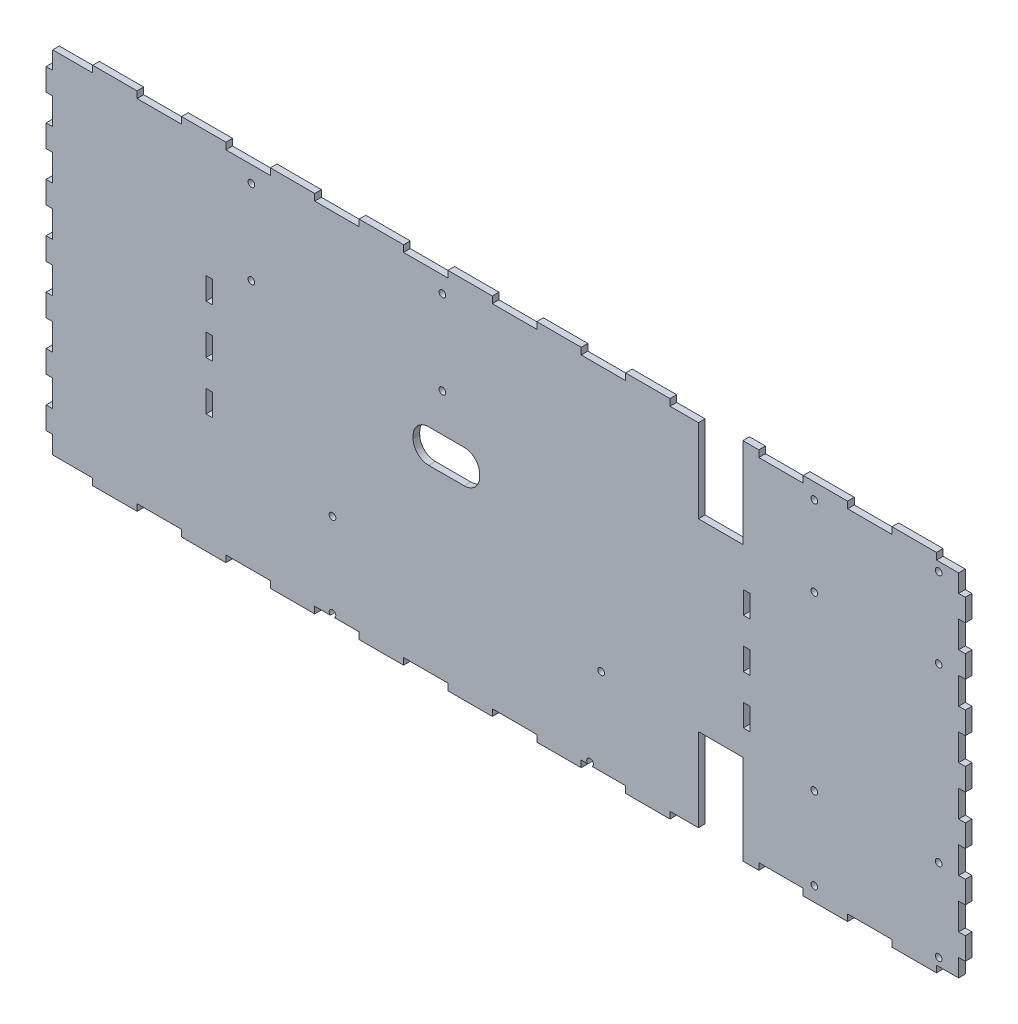
from build123d import *

# Parameters (mm, degrees)
SKETCH1_W           = 414
SKETCH1_H           = 164
BOSS_EXTRUDE1_DEPTH = 3
SKETCH2_W           = 3
SKETCH2_H           = 11
SKETCH2_H_2         = 12
CUT_EXTRUDE1_DEPTH  = 3
CUT_EXTRUDE2_DEPTH  = 3
SKETCH4_R           = 1.5
SKETCH4_W           = 3
SKETCH4_H           = 10
CUT_EXTRUDE3_DEPTH  = 10
SKETCH5_W           = 20
SKETCH5_H           = 40.5
CUT_EXTRUDE4_DEPTH  = 10


with BuildPart() as part:
    # Sketch1 → Boss-Extrude1 (new body)
    with BuildSketch(Plane.XY.offset(152)):
        Rectangle(SKETCH1_W, SKETCH1_H)
    extrude(amount=BOSS_EXTRUDE1_DEPTH)

    # Sketch2 → Cut-Extrude1 (cut)
    with BuildSketch(Plane.ZY.offset(207)):
        with Locations((153.5, -76.5)):
            Rectangle(SKETCH2_W, SKETCH2_H)
        with Locations((153.5, -55)):
            Rectangle(SKETCH2_W, SKETCH2_H_2)
        with Locations((153.5, -33)):
            Rectangle(SKETCH2_W, SKETCH2_H_2)
        with Locations((153.5, -11)):
            Rectangle(SKETCH2_W, SKETCH2_H_2)
        with Locations((153.5, 11)):
            Rectangle(SKETCH2_W, SKETCH2_H_2)
        with Locations((153.5, 33)):
            Rectangle(SKETCH2_W, SKETCH2_H_2)
        with Locations((153.5, 55)):
            Rectangle(SKETCH2_W, SKETCH2_H_2)
        with Locations((153.5, 76.5)):
            Rectangle(SKETCH2_W, SKETCH2_H)
    cut_extrude1 = extrude(amount=-CUT_EXTRUDE1_DEPTH, mode=Mode.SUBTRACT)

    # Mirror1: Cut-Extrude1 across plane
    add(cut_extrude1.mirror(Plane(origin=(0, 0, 0), x_dir=(0, 0, 1), z_dir=(1, 0, 0))), mode=Mode.SUBTRACT)

    # Sketch3 → Cut-Extrude2 (cut)
    with BuildSketch(Plane(origin=(0, 82, 0), x_dir=(1, 0, 0), z_dir=(0, 1, 0))):
        Polygon((174, -152), (194, -152), (194, -155), (204, -155), (204, -145), (207, -145), (207, -133), (204, -133), (204, -123), (207, -123), (207, -111), (204, -111), (204, -101), (207, -101), (207, -89), (204, -89), (204, -79), (207, -79), (207, -67), (204, -67), (204, -57), (207, -57), (207, -45), (204, -45), (204, -35), (207, -35), (207, -23), (204, -23), (204, -16), (-204, -16), (-204, -23), (-207, -23), (-207, -35), (-204, -35), (-204, -45), (-207, -45), (-207, -57), (-204, -57), (-204, -67), (-207, -67), (-207, -79), (-204, -79), (-204, -89), (-207, -89), (-207, -101), (-204, -101), (-204, -111), (-207, -111), (-207, -123), (-204, -123), (-204, -133), (-207, -133), (-207, -145), (-204, -145), (-204, -155), (-186, -155), (-186, -152), (-166, -152), (-166, -155), (-146, -155), (-146, -152), (-126, -152), (-126, -155), (-106, -155), (-106, -152), (-86, -152), (-86, -155), (-66, -155), (-66, -152), (-46, -152), (-46, -155), (-26, -155), (-26, -152), (-6, -152), (-6, -155), (14, -155), (14, -152), (34, -152), (34, -155), (54, -155), (54, -152), (74, -152), (74, -155), (94, -155), (94, -152), (114, -152), (114, -155), (134, -155), (134, -152), (154, -152), (154, -155), (174, -155), align=None)
    cut_extrude2 = extrude(amount=-CUT_EXTRUDE2_DEPTH, mode=Mode.SUBTRACT)

    # Mirror2: Cut-Extrude2 across plane
    add(cut_extrude2.mirror(Plane.ZX), mode=Mode.SUBTRACT)

    # Sketch4 → Cut-Extrude3 (cut)
    with BuildSketch(Plane.XY.offset(155)):
        with Locations((139, 39)):
            Circle(SKETCH4_R)
        with Locations((195, 39)):
            Circle(SKETCH4_R)
        with Locations((195, 75)):
            Circle(SKETCH4_R)
        with Locations((139, 75)):
            Circle(SKETCH4_R)
        with Locations((139, -75.5)):
            Circle(SKETCH4_R)
        with Locations((195, -75.5)):
            Circle(SKETCH4_R)
        with Locations((195, -38.5)):
            Circle(SKETCH4_R)
        with Locations((139, -38.5)):
            Circle(SKETCH4_R)
        with Locations((-114.499999999, 33.724097136)):
            Circle(SKETCH4_R)
        with Locations((-114.499999999, 71.624097136)):
            Circle(SKETCH4_R)
        with Locations((-28.499999999, 33.724097136)):
            Circle(SKETCH4_R)
        with Locations((-28.499999999, 71.624097136)):
            Circle(SKETCH4_R)
        with Locations((38, -77.875902864)):
            Circle(SKETCH4_R)
        with Locations((43, -39.975902864)):
            Circle(SKETCH4_R)
        with Locations((-78, -77.875902864)):
            Circle(SKETCH4_R)
        with Locations((-78, -39.975902864)):
            Circle(SKETCH4_R)
        with Locations((-133.5, 20.512048626)):
            Rectangle(SKETCH4_W, SKETCH4_H)
        with Locations((-133.5, -1.487951374)):
            Rectangle(SKETCH4_W, SKETCH4_H)
        with Locations((-133.5, -23.487951374)):
            Rectangle(SKETCH4_W, SKETCH4_H)
        with Locations((108.5, 19.024097136)):
            Rectangle(SKETCH4_W, SKETCH4_H)
        with Locations((108.5, -2.975902864)):
            Rectangle(SKETCH4_W, SKETCH4_H)
        with Locations((108.5, -24.975902864)):
            Rectangle(SKETCH4_W, SKETCH4_H)
    extrude(amount=-CUT_EXTRUDE3_DEPTH, mode=Mode.SUBTRACT)

    # Sketch5 → Cut-Extrude4 (cut)
    with BuildSketch(Plane.XY.offset(155)):
        with BuildLine():
            Line((-34.7, 1.624097136), (-18.7, 1.624097136))
            ThreePointArc((-18.7, 1.624097136), (-13.750252532, 3.674349668), (-11.7, 8.624097136))
            Line((-11.7, 8.624097136), (-11.7, 9.624097136))
            ThreePointArc((-11.7, 9.624097136), (-13.750252532, 14.573844605), (-18.7, 16.624097136))
            Line((-18.7, 16.624097136), (-34.7, 16.624097136))
            ThreePointArc((-34.7, 16.624097136), (-39.649747468, 14.573844605), (-41.7, 9.624097136))
            Line((-41.7, 9.624097136), (-41.7, 8.624097136))
            ThreePointArc((-41.7, 8.624097136), (-39.649747468, 3.674349668), (-34.7, 1.624097136))
        make_face()
        with Locations((96.8, 61.75)):
            Rectangle(SKETCH5_W, SKETCH5_H)
        with Locations((96.8, -61.75)):
            Rectangle(SKETCH5_W, SKETCH5_H)
    extrude(amount=-CUT_EXTRUDE4_DEPTH, mode=Mode.SUBTRACT)


solid = part.part
